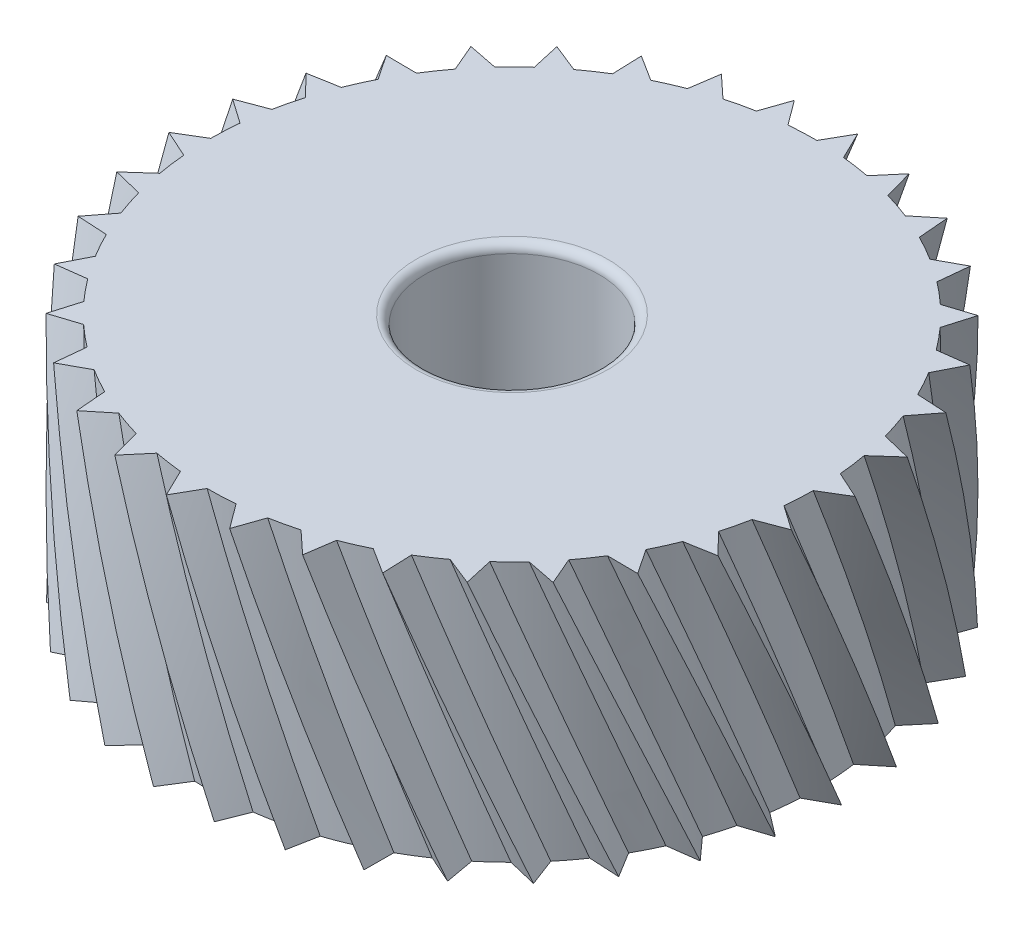
from build123d import *

# Parameters (mm, degrees)
ESQUISSE1_R                           = 18.75
BOSS_EXTRU_2_DEPTH                    = 14.8
ESQUISSE9_R                           = 4.95
ENL_V_MAT_EXTRU_1_DEPTH               = 50
ENL_VEMENT_DE_MATI_RE_BALAYAGE4_PITCH = 284
R_P_TITION_CIRCULAIRE2_COUNT          = 34
CONG_1_R                              = 0.5


with BuildPart() as part:
    # Esquisse1 → Boss.-Extru.2 (new body)
    with BuildSketch(Plane(origin=(0, 0, 0), x_dir=(1, 0, 0), z_dir=(0, 1, 0))):
        with Locations(Location((0, 0, 0), (0, 0, 270))):
            Circle(ESQUISSE1_R)
    extrude(amount=BOSS_EXTRU_2_DEPTH)

    # Esquisse9 → Enlèv. mat.-Extru.1 (cut)
    with BuildSketch(Plane(origin=(0, 14.8, 0), x_dir=(1, 0, 0), z_dir=(0, 1, 0))):
        with Locations(Location((0, 0, 0), (0, 0, 270))):
            Circle(ESQUISSE9_R)
    extrude(amount=-ENL_V_MAT_EXTRU_1_DEPTH, mode=Mode.SUBTRACT)

    # Enlèvement de matière-Balayage4: the profile of Esquisse12 screwed along a left-hand helix of 0.052113 turns, 48 arcs to a turn; built about Z, then put on its axis
    enl_vement_de_mati_re_balayage4_z = Axis((0, 0, 0), (0, 0, 1))
    enl_vement_de_mati_re_balayage4_corners = [(-3.445301756, -18.430745937, 0), (-1.912441629, -20.568933025, 0), (0, -18.75, 0), (-0.835206873, -17.229768701, 0), (-2.412460458, -17.080472316, 0)]
    with BuildLine(mode=Mode.PRIVATE) as enl_vement_de_mati_re_balayage4_profile:
        Line(enl_vement_de_mati_re_balayage4_corners[0], enl_vement_de_mati_re_balayage4_corners[1])
        Line(enl_vement_de_mati_re_balayage4_corners[1], enl_vement_de_mati_re_balayage4_corners[2])
        Line(enl_vement_de_mati_re_balayage4_corners[2], enl_vement_de_mati_re_balayage4_corners[3])
        Line(enl_vement_de_mati_re_balayage4_corners[4], enl_vement_de_mati_re_balayage4_corners[0])
        ThreePointArc((-0.835206873, -17.229768701, 0), (-1.625548561, -17.173237664, 0), (-2.412460458, -17.080472316, 0))
    enl_vement_de_mati_re_balayage4_cap = Face(enl_vement_de_mati_re_balayage4_profile.wire())
    enl_vement_de_mati_re_balayage4_arcs = [((-0.835206873, -17.229768701, 0), (-1.627265268, -17.191373953, 0), (-2.412460458, -17.080472316, 0), (1, 0.9989450355087895, 1))]  # start, shoulder, end, weights
    enl_vement_de_mati_re_balayage4_turn_angles = [0, -3.75, -7.5, -11.25, -15, -16.88028169, -18.76056338]
    enl_vement_de_mati_re_balayage4_turn_weights = [1, 0.9978589232386035, 1, 0.9978589232386035, 1, 0.9994615670904183, 1]
    enl_vement_de_mati_re_balayage4_turn_rails = [Edge.make_bspline([Vector(p[0], p[1], 0).rotate(enl_vement_de_mati_re_balayage4_z, enl_vement_de_mati_re_balayage4_turn_angles[k]) / enl_vement_de_mati_re_balayage4_turn_weights[k] + Vector(0, 0, p[2] + -ENL_VEMENT_DE_MATI_RE_BALAYAGE4_PITCH * enl_vement_de_mati_re_balayage4_turn_angles[k] / 360) for k in range(7)], [0, 0, 0, 1, 1, 2, 2, 3, 3, 3], 2, enl_vement_de_mati_re_balayage4_turn_weights) for p in enl_vement_de_mati_re_balayage4_corners]
    enl_vement_de_mati_re_balayage4_turn_sides = [*[Face.make_surface_from_curves(enl_vement_de_mati_re_balayage4_turn_rails[p[0]], enl_vement_de_mati_re_balayage4_turn_rails[p[1]]) for p in [(0, 1), (1, 2), (2, 3), (4, 0)]], *[Face.make_bezier_surface([[Vector(p[j][0], p[j][1], 0).rotate(enl_vement_de_mati_re_balayage4_z, enl_vement_de_mati_re_balayage4_turn_angles[2 * i + k]) / enl_vement_de_mati_re_balayage4_turn_weights[2 * i + k] + Vector(0, 0, p[j][2] + -ENL_VEMENT_DE_MATI_RE_BALAYAGE4_PITCH * enl_vement_de_mati_re_balayage4_turn_angles[2 * i + k] / 360) for k in range(3)] for j in range(3)], [[p[3][j] * enl_vement_de_mati_re_balayage4_turn_weights[2 * i + k] for k in range(3)] for j in range(3)]) for p in enl_vement_de_mati_re_balayage4_arcs for i in range(3)]]
    enl_vement_de_mati_re_balayage4 = Plane(origin=(0, 0, 0), x_dir=(0, 0, 1), z_dir=(0, 1, 0)) * Solid(Shell([*enl_vement_de_mati_re_balayage4_turn_sides, enl_vement_de_mati_re_balayage4_cap, enl_vement_de_mati_re_balayage4_cap.rotate(enl_vement_de_mati_re_balayage4_z, -18.76056338).moved(Location((0, 0, -ENL_VEMENT_DE_MATI_RE_BALAYAGE4_PITCH * -18.76056338 / 360)))]))
    add(enl_vement_de_mati_re_balayage4, mode=Mode.SUBTRACT)

    # Répétition circulaire2: Enlèvement de matière-Balayage4 ×34 about axis
    r_p_tition_circulaire2_axis = Axis((0, 14.8, 0), (0, -1, 0))
    for i in range(1, R_P_TITION_CIRCULAIRE2_COUNT):
        add(enl_vement_de_mati_re_balayage4.rotate(r_p_tition_circulaire2_axis, i * 360 / R_P_TITION_CIRCULAIRE2_COUNT), mode=Mode.SUBTRACT)

    # Congé1
    cong_1_edges = [part.edges().sort_by_distance(p)[0] for p in [
        (0, 0, -4.95),
        (0, 14.8, -4.95),
    ]]
    fillet(cong_1_edges, radius=CONG_1_R)


solid = part.part
